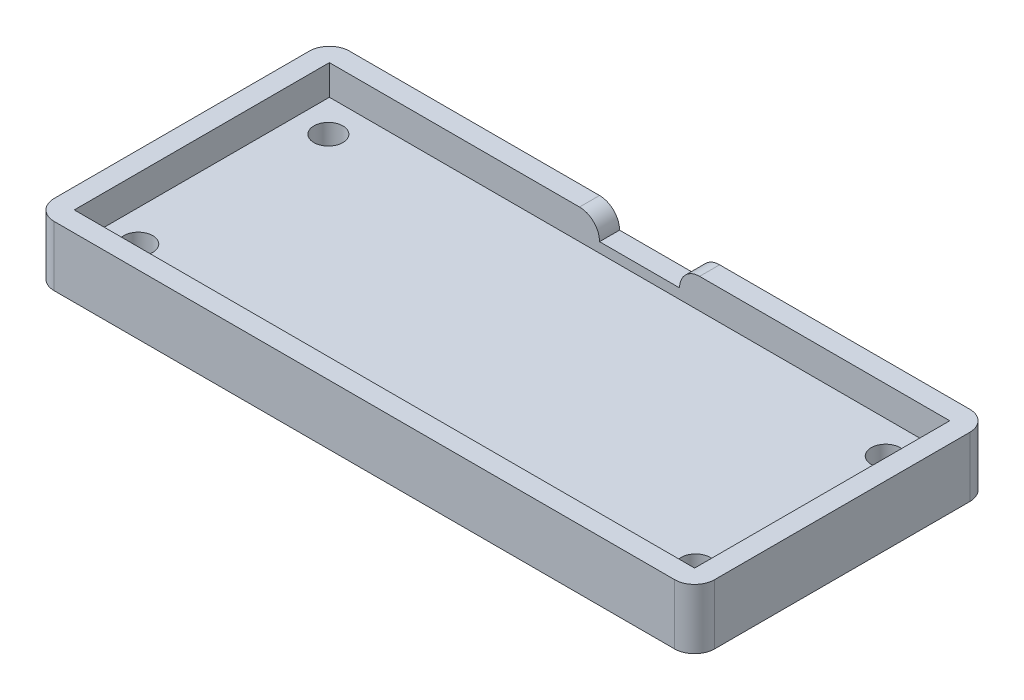
from build123d import *

# Parameters (mm, degrees)
SKETCH1_W           = 66
SKETCH1_H           = 29.5
SKETCH1_W_2         = 62
SKETCH1_H_2         = 25.5
SKETCH1_R           = 1.45
BOSS_EXTRUDE1_DEPTH = 3
SKETCH1_3_W         = 66
SKETCH1_3_H         = 29.5
SKETCH1_3_W_2       = 62
SKETCH1_3_H_2       = 25.5
BOSS_EXTRUDE3_DEPTH = 6
FILLET1_R           = 2
SKETCH2_W           = 8
SKETCH2_H           = 2
CUT_EXTRUDE1_DEPTH  = 2
FILLET2_R           = 2


with BuildPart() as part:
    # Sketch1 → Boss-Extrude1 (new body)
    # profile 1 of 2: a face of its own
    with BuildSketch(Plane(origin=(0, 0, 0), x_dir=(1, 0, 0), z_dir=(0, 1, 0))):
        with Locations((27.85, 9.5)):
            Rectangle(SKETCH1_W, SKETCH1_H)
        with Locations((27.85, 9.5)):
            Rectangle(SKETCH1_W_2, SKETCH1_H_2, mode=Mode.SUBTRACT)
    # profile 2 of 2: a face of its own
    with BuildSketch(Plane(origin=(0, 0, 0), x_dir=(1, 0, 0), z_dir=(0, 1, 0))):
        with Locations((27.85, 9.5)):
            Rectangle(SKETCH1_W_2, SKETCH1_H_2)
        with Locations(Location((55.7, 19, 0), (0, 0, 270))):
            Circle(SKETCH1_R, mode=Mode.SUBTRACT)
        with Locations(Location((0, 19, 0), (0, 0, 270))):
            Circle(SKETCH1_R, mode=Mode.SUBTRACT)
        with Locations(Location((55.7, 0, 0), (0, 0, 270))):
            Circle(SKETCH1_R, mode=Mode.SUBTRACT)
        with Locations(Location((0, 0, 0), (0, 0, 270))):
            Circle(SKETCH1_R, mode=Mode.SUBTRACT)
    extrude(amount=BOSS_EXTRUDE1_DEPTH)

    # Sketch1<3> → Boss-Extrude3 (add)
    with BuildSketch(Plane(origin=(0, 0, 0), x_dir=(1, 0, 0), z_dir=(0, 1, 0))):
        with Locations((27.85, 9.5)):
            Rectangle(SKETCH1_3_W, SKETCH1_3_H)
        with Locations((27.85, 9.5)):
            Rectangle(SKETCH1_3_W_2, SKETCH1_3_H_2, mode=Mode.SUBTRACT)
    extrude(amount=BOSS_EXTRUDE3_DEPTH)

    # Fillet1
    fillet1_edges = [part.edges().sort_by_distance(p)[0] for p in [
        (-5.15, 3, -24.25),
        (60.85, 3, -24.25),
        (60.85, 3, 5.25),
        (-5.15, 3, 5.25),
    ]]
    fillet(fillet1_edges, radius=FILLET1_R)

    # Sketch2 → Cut-Extrude1 (cut)
    with BuildSketch(Plane(origin=(0, 6, 0), x_dir=(1, 0, 0), z_dir=(0, 1, 0))):
        with Locations((27.85, 23.25)):
            Rectangle(SKETCH2_W, SKETCH2_H)
    extrude(amount=-CUT_EXTRUDE1_DEPTH, mode=Mode.SUBTRACT)

    # Fillet2
    fillet2_edges = [part.edges().sort_by_distance(p)[0] for p in [
        (31.85, 6, -23.25),
        (23.85, 6, -23.25),
    ]]
    fillet(fillet2_edges, radius=FILLET2_R - 0.0001)  # a hair under: the kernel refuses the full size


solid = part.part
